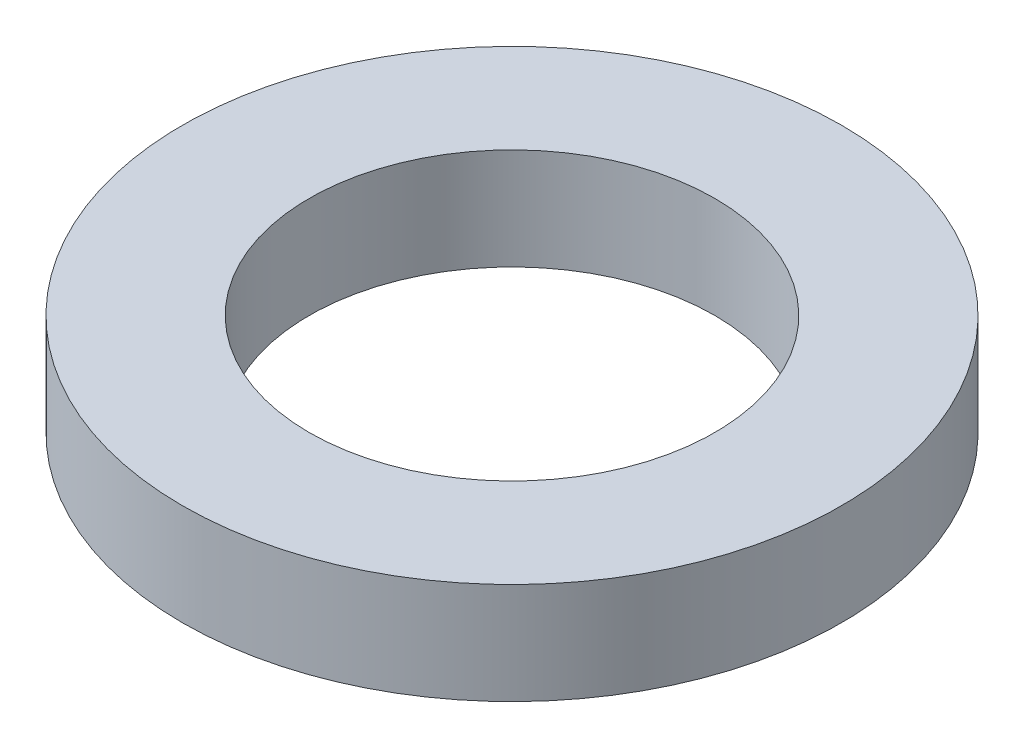
from build123d import *

# Parameters (mm, degrees)
SKETCH1_R           = 65
BOSS_EXTRUDE1_DEPTH = 20
SKETCH2_R           = 40
CUT_EXTRUDE1_DEPTH  = 95.074438611


with BuildPart() as part:
    # Sketch1 → Boss-Extrude1 (new body)
    with BuildSketch(Plane(origin=(0, 0, 0), x_dir=(1, 0, 0), z_dir=(0, 1, 0))):
        Circle(SKETCH1_R)
    extrude(amount=BOSS_EXTRUDE1_DEPTH)

    # Sketch2 → Cut-Extrude1 (cut, through all)
    with BuildSketch(Plane(origin=(0, 0, 0), x_dir=(1, 0, 0), z_dir=(0, 1, 0))):
        Circle(SKETCH2_R)
    extrude(amount=CUT_EXTRUDE1_DEPTH, mode=Mode.SUBTRACT)


solid = part.part
